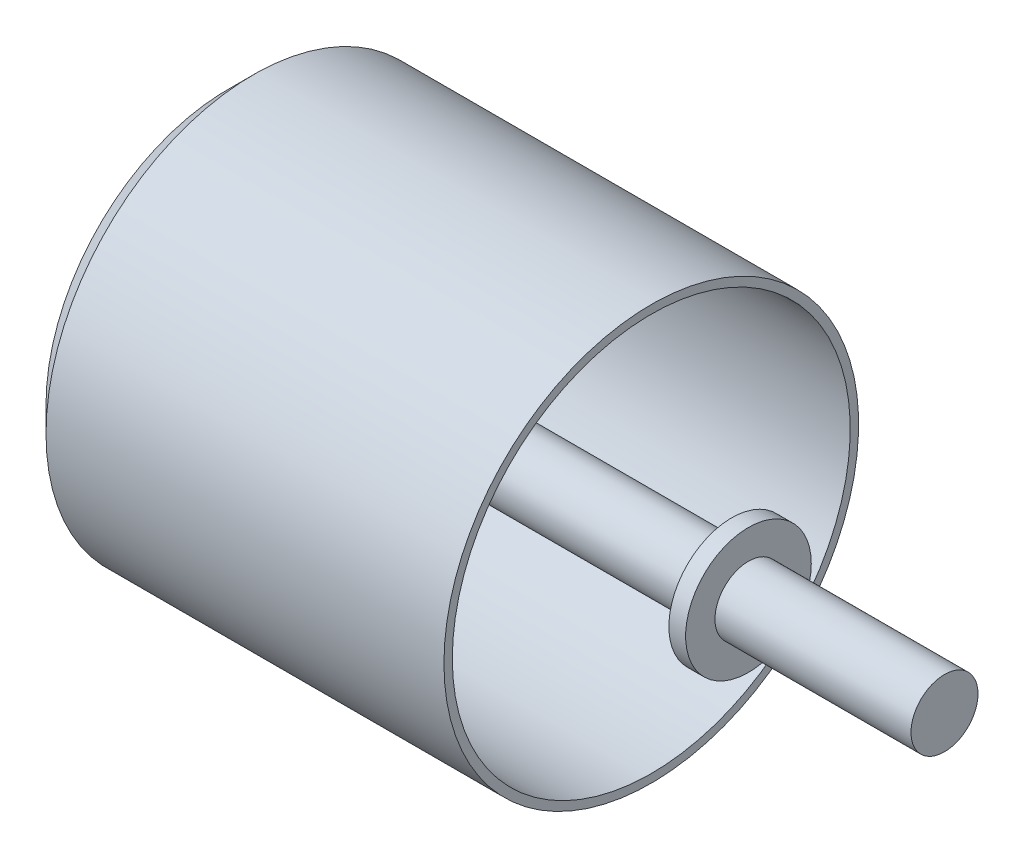
from build123d import *

# Parameters (mm, degrees)
SKETCH2_R           = 4
BOSS_EXTRUDE1_DEPTH = 85.5
SKETCH3_R           = 3.5
CUT_EXTRUDE1_DEPTH  = 93.387093254
SKETCH4_R           = 7.5
BOSS_EXTRUDE2_DEPTH = 2


with BuildPart() as part:
    # Sketch1 → Revolve1 (revolve)
    with BuildSketch(Plane.XY):
        Polygon((0, 21.75), (3, 24.75), (50.5, 24.75), (50.5, 23.75), (3.414213562, 23.75), (1, 21.335786438), (1, 0), (0, 0), align=None)
    revolve(axis=Axis((0, 0, 0), (1, 0, 0)))

    # Sketch2 → Boss-Extrude1 (add)
    with BuildSketch(Plane(origin=(0, 0, 0), x_dir=(0, 0, -1), z_dir=(1, 0, 0))):
        Circle(SKETCH2_R)
    extrude(amount=BOSS_EXTRUDE1_DEPTH)

    # Sketch3 → Cut-Extrude1 (cut, through all)
    with BuildSketch(Plane.ZY):
        with Locations((0, 17)):
            Circle(SKETCH3_R)
        with Locations((17, 0)):
            Circle(SKETCH3_R)
        with Locations((0, -17)):
            Circle(SKETCH3_R)
        with Locations((-17, 0)):
            Circle(SKETCH3_R)
    extrude(amount=-CUT_EXTRUDE1_DEPTH, mode=Mode.SUBTRACT)

    # Sketch4 → Boss-Extrude2 (add)
    with BuildSketch(Plane(origin=(60.1, 0, 0), x_dir=(0, 0, -1), z_dir=(1, 0, 0))):
        Circle(SKETCH4_R)
    extrude(amount=BOSS_EXTRUDE2_DEPTH)


solid = part.part
